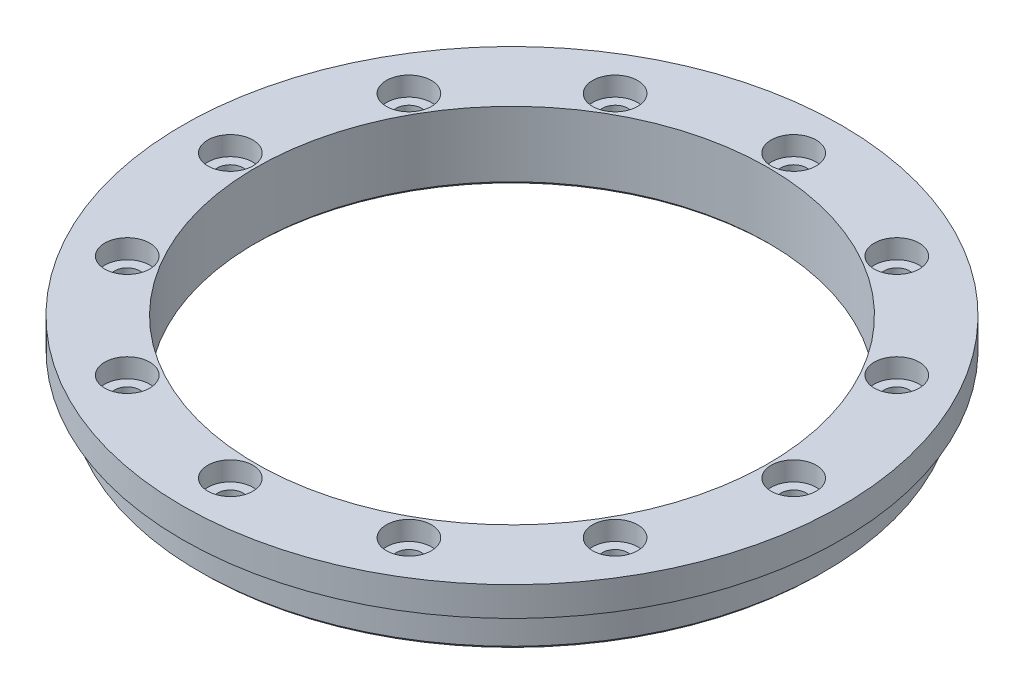
from build123d import *

# Parameters (mm, degrees)
CBORE_FOR_M4_HEX_SOCKET_HEAD_CAP_SCR_2_COUNT  = 2
CBORE_FOR_M4_HEX_SOCKET_HEAD_CAP_SCR_2_PITCH  = 25.88190451
CBORE_FOR_M4_HEX_SOCKET_HEAD_CAP_SCR_3_COUNT  = 2
CBORE_FOR_M4_HEX_SOCKET_HEAD_CAP_SCR_3_PITCH  = 50
CBORE_FOR_M4_HEX_SOCKET_HEAD_CAP_SCR_4_COUNT  = 2
CBORE_FOR_M4_HEX_SOCKET_HEAD_CAP_SCR_4_PITCH  = 70.710678119
CBORE_FOR_M4_HEX_SOCKET_HEAD_CAP_SCR_5_COUNT  = 2
CBORE_FOR_M4_HEX_SOCKET_HEAD_CAP_SCR_5_PITCH  = 86.602540378
CBORE_FOR_M4_HEX_SOCKET_HEAD_CAP_SCR_6_COUNT  = 2
CBORE_FOR_M4_HEX_SOCKET_HEAD_CAP_SCR_6_PITCH  = 96.592582629
CBORE_FOR_M4_HEX_SOCKET_HEAD_CAP_SCR_7_COUNT  = 2
CBORE_FOR_M4_HEX_SOCKET_HEAD_CAP_SCR_7_PITCH  = 100
CBORE_FOR_M4_HEX_SOCKET_HEAD_CAP_SCR_8_COUNT  = 2
CBORE_FOR_M4_HEX_SOCKET_HEAD_CAP_SCR_8_PITCH  = 96.592582629
CBORE_FOR_M4_HEX_SOCKET_HEAD_CAP_SCR_9_COUNT  = 2
CBORE_FOR_M4_HEX_SOCKET_HEAD_CAP_SCR_9_PITCH  = 86.602540378
CBORE_FOR_M4_HEX_SOCKET_HEAD_CAP_SCR_10_COUNT = 2
CBORE_FOR_M4_HEX_SOCKET_HEAD_CAP_SCR_10_PITCH = 70.710678119
CBORE_FOR_M4_HEX_SOCKET_HEAD_CAP_SCR_11_COUNT = 2
CBORE_FOR_M4_HEX_SOCKET_HEAD_CAP_SCR_11_PITCH = 50
CBORE_FOR_M4_HEX_SOCKET_HEAD_CAP_SCR_12_COUNT = 2
CBORE_FOR_M4_HEX_SOCKET_HEAD_CAP_SCR_12_PITCH = 25.88190451
M4_TAPPED_HOLE1_AT_2_COUNT                    = 2
M4_TAPPED_HOLE1_AT_2_PITCH                    = 25.88190451
M4_TAPPED_HOLE1_AT_3_COUNT                    = 2
M4_TAPPED_HOLE1_AT_3_PITCH                    = 50
M4_TAPPED_HOLE1_AT_4_COUNT                    = 2
M4_TAPPED_HOLE1_AT_4_PITCH                    = 70.710678119
M4_TAPPED_HOLE1_AT_5_COUNT                    = 2
M4_TAPPED_HOLE1_AT_5_PITCH                    = 86.602540378
M4_TAPPED_HOLE1_AT_6_COUNT                    = 2
M4_TAPPED_HOLE1_AT_6_PITCH                    = 96.592582629
M4_TAPPED_HOLE1_AT_7_COUNT                    = 2
M4_TAPPED_HOLE1_AT_7_PITCH                    = 100
M4_TAPPED_HOLE1_AT_8_COUNT                    = 2
M4_TAPPED_HOLE1_AT_8_PITCH                    = 96.592582629
M4_TAPPED_HOLE1_AT_9_COUNT                    = 2
M4_TAPPED_HOLE1_AT_9_PITCH                    = 86.602540378
M4_TAPPED_HOLE1_AT_10_COUNT                   = 2
M4_TAPPED_HOLE1_AT_10_PITCH                   = 70.710678119
M4_TAPPED_HOLE1_AT_11_COUNT                   = 2
M4_TAPPED_HOLE1_AT_11_PITCH                   = 50
M4_TAPPED_HOLE1_AT_12_COUNT                   = 2
M4_TAPPED_HOLE1_AT_12_PITCH                   = 25.88190451
SKETCH36_W                                    = 2.25
SKETCH36_H                                    = 3.5
M4_CLEARANCE_HOLE1_AT_2_COUNT                 = 2
M4_CLEARANCE_HOLE1_AT_2_PITCH                 = 35.58955921
M4_CLEARANCE_HOLE1_AT_3_COUNT                 = 2
M4_CLEARANCE_HOLE1_AT_3_PITCH                 = 65.76093065
M4_CLEARANCE_HOLE1_AT_4_COUNT                 = 2
M4_CLEARANCE_HOLE1_AT_4_PITCH                 = 85.920796524
M4_CLEARANCE_HOLE1_AT_5_COUNT                 = 2
M4_CLEARANCE_HOLE1_AT_5_PITCH                 = 93
M4_CLEARANCE_HOLE1_AT_6_COUNT                 = 2
M4_CLEARANCE_HOLE1_AT_6_PITCH                 = 85.920796524
M4_CLEARANCE_HOLE1_AT_7_COUNT                 = 2
M4_CLEARANCE_HOLE1_AT_7_PITCH                 = 65.76093065
M4_CLEARANCE_HOLE1_AT_8_COUNT                 = 2
M4_CLEARANCE_HOLE1_AT_8_PITCH                 = 35.58955921
M4_TAPPED_HOLE2_AT_2_COUNT                    = 2
M4_TAPPED_HOLE2_AT_2_PITCH                    = 35.58955921
M4_TAPPED_HOLE2_AT_3_COUNT                    = 2
M4_TAPPED_HOLE2_AT_3_PITCH                    = 35.58955921
M4_TAPPED_HOLE2_AT_4_COUNT                    = 2
M4_TAPPED_HOLE2_AT_4_PITCH                    = 65.76093065
M4_TAPPED_HOLE2_AT_5_COUNT                    = 2
M4_TAPPED_HOLE2_AT_5_PITCH                    = 65.76093065
M4_TAPPED_HOLE2_AT_6_COUNT                    = 2
M4_TAPPED_HOLE2_AT_6_PITCH                    = 85.920796524
M4_TAPPED_HOLE2_AT_7_COUNT                    = 2
M4_TAPPED_HOLE2_AT_7_PITCH                    = 93
M4_TAPPED_HOLE2_AT_8_COUNT                    = 2
M4_TAPPED_HOLE2_AT_8_PITCH                    = 85.920796524
SKETCH53_W                                    = 2.5
SKETCH53_H                                    = 54.5
M6_TAPPED_HOLE1_AT_2_COUNT                    = 2
M6_TAPPED_HOLE1_AT_2_PITCH                    = 45
MIRROR1_COPY_1_SKETCH_W                       = 2.5
MIRROR1_COPY_1_SKETCH_H                       = 54.5
SKETCH66_W                                    = 2.5
SKETCH66_H                                    = 54.5
M6_TAPPED_HOLE2_AT_2_COUNT                    = 2
M6_TAPPED_HOLE2_AT_2_PITCH                    = 45
MIRROR2_COPY_1_SKETCH_W                       = 2.5
MIRROR2_COPY_1_SKETCH_H                       = 54.5
SKETCH69_W                                    = 1
SKETCH69_H                                    = 1
CHAMFER5_SIZE                                 = 0.5
MOVE_FACE2_BY                                 = 0.5
MOVE_FACE3_BY                                 = 1
CHAMFER1_SIZE                                 = 0.6
CHAMFER2_SIZE                                 = 0.6
FILLET3_R                                     = 0.4
CHAMFER3_SIZE                                 = 2
M6_START                                      = -56
M6_TAPPED_HOLE3_OUTLINE_R                     = 2.5
M6_TAPPED_HOLE3_DEPTH                         = 14
CHAMFER4_SIZE                                 = 0.6
CHAMFER6_SIZE                                 = 0.6
FILLET4_R                                     = 0.4
CHAMFER7_SIZE                                 = 1
CHAMFER7_SIZE2                                = 1.732050808
CHAMFER8_SIZE                                 = 0.5
CHAMFER8_SIZE2                                = 0.866025404


with BuildPart() as part:
    # Sketch1 → Revolve1 (revolve)
    with BuildSketch(Plane(origin=(0, 0, 0), x_dir=(0, 0, -1), z_dir=(1, 0, 0))):
        Polygon((37, 103.8), (37, 100.8), (30.5, 100.8), (30.5, 96.8), (40, 93), (40, 91), (42.5, 91), (42.5, 78), (43, 78), (43, -18.5), (42.5, -18.5), (42.5, -31.5), (42.5, -32.5), (50.5, -32.5), (50.5, -36), (54.5, -36), (54.5, -32.5), (54.5, 43.7), (58.5, 43.7), (58.5, 49.7), (55.5, 49.7), (55.5, 57.7), (54.5, 57.7), (54.5, 90.3), (45.5, 90.3), (45.5, 103.8), (42.5, 103.8), align=None)
    revolve(axis=Axis((0, 0, 0), (0, 1, 0)))

    # Sketch56 → Cut-Revolve1 (revolve, cut)
    with BuildSketch(Plane(origin=(0, 0, 0), x_dir=(0, 0, -1), z_dir=(1, 0, 0))):
        Polygon((45.5, 103.8), (37, 103.8), (0, 103.8), (0, 93), (40, 93), (45.5, 93), align=None)
    revolve(axis=Axis((0, 108.9, 0), (0, -1, 0)), mode=Mode.SUBTRACT)

    # Sketch57 → Revolve4 (revolve)
    with BuildSketch(Plane(origin=(0, 0, 0), x_dir=(0, 0, -1), z_dir=(1, 0, 0))):
        Polygon((29.65, 98), (45.5, 98), (45.5, 93), (40, 93), (40, 95), (23.25, 95), (20.25, 95), (20.25, 102), (29.65, 102), align=None)
    revolve(axis=Axis((0, 108.9, 0), (0, -1, 0)))

    # Sketch22 → M4 Tapped Hole1 (revolve, cut)
    with BuildSketch(Plane(origin=(0, 90.3, -50), x_dir=(0, 0, 1), z_dir=(1, 0, 0))):
        Polygon((0, 0), (0, 11.091420021), (1.65, 10.1), (1.65, 0), align=None)
    m4_tapped_hole1 = revolve(axis=Axis((0, 96.65, -50), (0, -1, 0)), mode=Mode.SUBTRACT)

    # M4 Tapped Hole1 at 2: M4 Tapped Hole1 ×2
    with Locations(*[Vector(0.9659258262890645, 0, 0.2588190451025349) * (i * M4_TAPPED_HOLE1_AT_2_PITCH) for i in range(1, M4_TAPPED_HOLE1_AT_2_COUNT)]):
        add(m4_tapped_hole1, mode=Mode.SUBTRACT)

    # M4 Tapped Hole1 at 3: M4 Tapped Hole1 ×2
    with Locations(*[Vector(0.8660254037844238, 0, 0.5000000000000259) * (i * M4_TAPPED_HOLE1_AT_3_PITCH) for i in range(1, M4_TAPPED_HOLE1_AT_3_COUNT)]):
        add(m4_tapped_hole1, mode=Mode.SUBTRACT)

    # M4 Tapped Hole1 at 4: M4 Tapped Hole1 ×2
    with Locations(*[Vector(0.7071067811865159, 0, 0.7071067811865791) * (i * M4_TAPPED_HOLE1_AT_4_PITCH) for i in range(1, M4_TAPPED_HOLE1_AT_4_COUNT)]):
        add(m4_tapped_hole1, mode=Mode.SUBTRACT)

    # M4 Tapped Hole1 at 5: M4 Tapped Hole1 ×2
    with Locations(*[Vector(0.4999999999999484, 0, 0.8660254037844685) * (i * M4_TAPPED_HOLE1_AT_5_PITCH) for i in range(1, M4_TAPPED_HOLE1_AT_5_COUNT)]):
        add(m4_tapped_hole1, mode=Mode.SUBTRACT)

    # M4 Tapped Hole1 at 6: M4 Tapped Hole1 ×2
    with Locations(*[Vector(0.2588190451024489, 0, 0.9659258262890876) * (i * M4_TAPPED_HOLE1_AT_6_PITCH) for i in range(1, M4_TAPPED_HOLE1_AT_6_COUNT)]):
        add(m4_tapped_hole1, mode=Mode.SUBTRACT)

    # M4 Tapped Hole1 at 7: M4 Tapped Hole1 ×2
    with Locations(*[(0, 0, i * M4_TAPPED_HOLE1_AT_7_PITCH) for i in range(1, M4_TAPPED_HOLE1_AT_7_COUNT)]):
        add(m4_tapped_hole1, mode=Mode.SUBTRACT)

    # M4 Tapped Hole1 at 8: M4 Tapped Hole1 ×2
    with Locations(*[Vector(-0.2588190451026216, 0, 0.9659258262890413) * (i * M4_TAPPED_HOLE1_AT_8_PITCH) for i in range(1, M4_TAPPED_HOLE1_AT_8_COUNT)]):
        add(m4_tapped_hole1, mode=Mode.SUBTRACT)

    # M4 Tapped Hole1 at 9: M4 Tapped Hole1 ×2
    with Locations(*[Vector(-0.5000000000001033, 0, 0.8660254037843791) * (i * M4_TAPPED_HOLE1_AT_9_PITCH) for i in range(1, M4_TAPPED_HOLE1_AT_9_COUNT)]):
        add(m4_tapped_hole1, mode=Mode.SUBTRACT)

    # M4 Tapped Hole1 at 10: M4 Tapped Hole1 ×2
    with Locations(*[Vector(-0.7071067811866423, 0, 0.7071067811864528) * (i * M4_TAPPED_HOLE1_AT_10_PITCH) for i in range(1, M4_TAPPED_HOLE1_AT_10_COUNT)]):
        add(m4_tapped_hole1, mode=Mode.SUBTRACT)

    # M4 Tapped Hole1 at 11: M4 Tapped Hole1 ×2
    with Locations(*[Vector(-0.8660254037845131, 0, 0.4999999999998711) * (i * M4_TAPPED_HOLE1_AT_11_PITCH) for i in range(1, M4_TAPPED_HOLE1_AT_11_COUNT)]):
        add(m4_tapped_hole1, mode=Mode.SUBTRACT)

    # M4 Tapped Hole1 at 12: M4 Tapped Hole1 ×2
    with Locations(*[Vector(-0.9659258262891108, 0, 0.2588190451023622) * (i * M4_TAPPED_HOLE1_AT_12_PITCH) for i in range(1, M4_TAPPED_HOLE1_AT_12_COUNT)]):
        add(m4_tapped_hole1, mode=Mode.SUBTRACT)

    # Sketch39 → M4 Tapped Hole2 (revolve, cut)
    with BuildSketch(Plane(origin=(17.794779605, -32.5, -42.960398262), x_dir=(0, 0, -1), z_dir=(1, 0, 0))):
        Polygon((0, 0), (0, 10.991420021), (1.65, 10), (1.65, 0), align=None)
    m4_tapped_hole2 = revolve(axis=Axis((17.794779605, -38.85, -42.960398262), (0, 1, 0)), mode=Mode.SUBTRACT)

    # M4 Tapped Hole2 at 2: M4 Tapped Hole2 ×2
    with Locations(*[Vector(0.7071067811867017, 0, 0.7071067811863935) * (i * M4_TAPPED_HOLE2_AT_2_PITCH) for i in range(1, M4_TAPPED_HOLE2_AT_2_COUNT)]):
        add(m4_tapped_hole2, mode=Mode.SUBTRACT)

    # M4 Tapped Hole2 at 3: M4 Tapped Hole2 ×2
    with Locations(*[(-i * M4_TAPPED_HOLE2_AT_3_PITCH, 0, 0) for i in range(1, M4_TAPPED_HOLE2_AT_3_COUNT)]):
        add(m4_tapped_hole2, mode=Mode.SUBTRACT)

    # M4 Tapped Hole2 at 4: M4 Tapped Hole2 ×2
    with Locations(*[Vector(-0.9238795325112329, 0, 0.38268343236522007) * (i * M4_TAPPED_HOLE2_AT_4_PITCH) for i in range(1, M4_TAPPED_HOLE2_AT_4_COUNT)]):
        add(m4_tapped_hole2, mode=Mode.SUBTRACT)

    # M4 Tapped Hole2 at 5: M4 Tapped Hole2 ×2
    with Locations(*[Vector(0.38268343236527674, 0, 0.9238795325112094) * (i * M4_TAPPED_HOLE2_AT_5_PITCH) for i in range(1, M4_TAPPED_HOLE2_AT_5_COUNT)]):
        add(m4_tapped_hole2, mode=Mode.SUBTRACT)

    # M4 Tapped Hole2 at 6: M4 Tapped Hole2 ×2
    with Locations(*[(0, 0, i * M4_TAPPED_HOLE2_AT_6_PITCH) for i in range(1, M4_TAPPED_HOLE2_AT_6_COUNT)]):
        add(m4_tapped_hole2, mode=Mode.SUBTRACT)

    # M4 Tapped Hole2 at 7: M4 Tapped Hole2 ×2
    with Locations(*[Vector(-0.38268343236493113, 0, 0.9238795325113525) * (i * M4_TAPPED_HOLE2_AT_7_PITCH) for i in range(1, M4_TAPPED_HOLE2_AT_7_COUNT)]):
        add(m4_tapped_hole2, mode=Mode.SUBTRACT)

    # M4 Tapped Hole2 at 8: M4 Tapped Hole2 ×2
    with Locations(*[Vector(-0.707106781186437, 0, 0.707106781186658) * (i * M4_TAPPED_HOLE2_AT_8_PITCH) for i in range(1, M4_TAPPED_HOLE2_AT_8_COUNT)]):
        add(m4_tapped_hole2, mode=Mode.SUBTRACT)

    # Sketch53 → M6 Tapped Hole1 (revolve, cut)
    with BuildSketch(Plane(origin=(38.537319575, 30.5, 38.537319575), x_dir=(0.7071067811865464, 0, -0.7071067811865487), z_dir=(0, 1, 0))):
        with Locations((1.25, 27.25)):
            Rectangle(SKETCH53_W, SKETCH53_H)
    m6_tapped_hole1 = revolve(axis=Axis((43.027447635, 30.5, 43.027447635), (-0.7071067811865487, 0, -0.7071067811865464)), mode=Mode.SUBTRACT)

    # M6 Tapped Hole1 at 2: M6 Tapped Hole1 ×2
    with Locations(*[(0, -i * M6_TAPPED_HOLE1_AT_2_PITCH, 0) for i in range(1, M6_TAPPED_HOLE1_AT_2_COUNT)]):
        add(m6_tapped_hole1, mode=Mode.SUBTRACT)

    # Mirror1: M6 Tapped Hole1 across plane
    add(m6_tapped_hole1.mirror(Plane(origin=(0, 0, 0), x_dir=(0, 0, 1), z_dir=(1, 0, 0))), mode=Mode.SUBTRACT)

    # Mirror1 copy 1 sketch → Mirror1 copy 1 (revolve, cut)
    with BuildSketch(Plane(origin=(-38.537319575, -14.5, 38.537319575), x_dir=(-0.7071067811865464, 0, -0.7071067811865487), z_dir=(0, 1, 0))):
        with Locations((1.25, -27.25)):
            Rectangle(MIRROR1_COPY_1_SKETCH_W, MIRROR1_COPY_1_SKETCH_H)
    revolve(axis=Axis((-43.027447635, -14.5, 43.027447635), (-0.7071067811865487, 0, 0.7071067811865464)), mode=Mode.SUBTRACT)

    # AdvancedHole1: read off the stored shape, not the designer's step
    # AdvancedHole1 outline → AdvancedHole1 (revolve, cut)
    with BuildSketch(Plane.XY.offset(22.75)):
        Polygon((0.8, 100.5), (1.2, 100.5), (1.2, 102), (0, 102), (0, 96.019311506), (0.8, 96.5), align=None)
    revolve(axis=Axis((0, 0, 22.75), (0, 1, 0)), mode=Mode.SUBTRACT)

    # AdvancedHole1 2 outline → AdvancedHole1 2 (revolve, cut)
    with BuildSketch(Plane(origin=(19.702077936, 0, -11.375), x_dir=(1, 0, 0), z_dir=(0, 0, 1))):
        Polygon((1.2, 102), (0, 102), (0, 96.019311506), (0.8, 96.5), (0.8, 100.5), (1.2, 100.5), align=None)
    revolve(axis=Axis((19.702077936, 0, -11.375), (0, 1, 0)), mode=Mode.SUBTRACT)

    # AdvancedHole1 3 outline → AdvancedHole1 3 (revolve, cut)
    with BuildSketch(Plane(origin=(-19.702077936, 0, -11.375), x_dir=(1, 0, 0), z_dir=(0, 0, 1))):
        Polygon((1.2, 102), (0, 102), (0, 96.019311506), (0.8, 96.5), (0.8, 100.5), (1.2, 100.5), align=None)
    revolve(axis=Axis((-19.702077936, 0, -11.375), (0, 1, 0)), mode=Mode.SUBTRACT)

    # Sketch66 → M6 Tapped Hole2 (revolve, cut)
    with BuildSketch(Plane(origin=(31.259915781, 30.5, 44.643786414), x_dir=(0.819152044288993, 0, -0.5735764363510444), z_dir=(0, 1, 0))):
        with Locations((1.25, 27.25)):
            Rectangle(SKETCH66_W, SKETCH66_H)
    m6_tapped_hole2 = revolve(axis=Axis((34.902126152, 30.5, 49.845401895), (-0.5735764363510444, 0, -0.8191520442889929)), mode=Mode.SUBTRACT)

    # M6 Tapped Hole2 at 2: M6 Tapped Hole2 ×2
    with Locations(*[(0, -i * M6_TAPPED_HOLE2_AT_2_PITCH, 0) for i in range(1, M6_TAPPED_HOLE2_AT_2_COUNT)]):
        add(m6_tapped_hole2, mode=Mode.SUBTRACT)

    # Mirror2: M6 Tapped Hole2 across plane
    add(m6_tapped_hole2.mirror(Plane(origin=(0, 0, 0), x_dir=(0, 0, 1), z_dir=(1, 0, 0))), mode=Mode.SUBTRACT)

    # Mirror2 copy 1 sketch → Mirror2 copy 1 (revolve, cut)
    with BuildSketch(Plane(origin=(-31.259915781, -14.5, 44.643786414), x_dir=(-0.819152044288993, 0, -0.5735764363510444), z_dir=(0, 1, 0))):
        with Locations((1.25, -27.25)):
            Rectangle(MIRROR2_COPY_1_SKETCH_W, MIRROR2_COPY_1_SKETCH_H)
    revolve(axis=Axis((-34.902126152, -14.5, 49.845401895), (-0.5735764363510444, 0, 0.8191520442889929)), mode=Mode.SUBTRACT)


with BuildPart() as body_2:
    # Sketch2 → Revolve2 (revolve)
    with BuildSketch(Plane(origin=(0, 0, 0), x_dir=(0, 0, -1), z_dir=(1, 0, 0)), mode=Mode.PRIVATE) as revolve2_sk:
        Polygon((42.5, -31.5), (40, -31.5), (40, -36), (50.5, -36), (50.5, -32.5), (42.5, -32.5), align=None)
    revolve(revolve2_sk.sketch.rotate(Axis((0, 108.9, 0), (0, -1, 0)), 180), axis=Axis((0, 108.9, 0), (0, -1, 0)))

    # Sketch36 → M4 Clearance Hole1 (revolve, cut)
    with BuildSketch(Plane(origin=(17.794779605, -36, -42.960398262), x_dir=(0, 0, -1), z_dir=(1, 0, 0))):
        with Locations((1.125, 1.75)):
            Rectangle(SKETCH36_W, SKETCH36_H)
    m4_clearance_hole1 = revolve(axis=Axis((17.794779605, -42.35, -42.960398262), (0, 1, 0)), mode=Mode.SUBTRACT)

    # M4 Clearance Hole1 at 2: M4 Clearance Hole1 ×2
    with Locations(*[(-i * M4_CLEARANCE_HOLE1_AT_2_PITCH, 0, 0) for i in range(1, M4_CLEARANCE_HOLE1_AT_2_COUNT)]):
        add(m4_clearance_hole1, mode=Mode.SUBTRACT)

    # M4 Clearance Hole1 at 3: M4 Clearance Hole1 ×2
    with Locations(*[Vector(-0.9238795325112329, 0, 0.38268343236522007) * (i * M4_CLEARANCE_HOLE1_AT_3_PITCH) for i in range(1, M4_CLEARANCE_HOLE1_AT_3_COUNT)]):
        add(m4_clearance_hole1, mode=Mode.SUBTRACT)

    # M4 Clearance Hole1 at 4: M4 Clearance Hole1 ×2
    with Locations(*[Vector(-0.707106781186437, 0, 0.707106781186658) * (i * M4_CLEARANCE_HOLE1_AT_4_PITCH) for i in range(1, M4_CLEARANCE_HOLE1_AT_4_COUNT)]):
        add(m4_clearance_hole1, mode=Mode.SUBTRACT)

    # M4 Clearance Hole1 at 5: M4 Clearance Hole1 ×2
    with Locations(*[Vector(-0.38268343236493113, 0, 0.9238795325113525) * (i * M4_CLEARANCE_HOLE1_AT_5_PITCH) for i in range(1, M4_CLEARANCE_HOLE1_AT_5_COUNT)]):
        add(m4_clearance_hole1, mode=Mode.SUBTRACT)

    # M4 Clearance Hole1 at 6: M4 Clearance Hole1 ×2
    with Locations(*[(0, 0, i * M4_CLEARANCE_HOLE1_AT_6_PITCH) for i in range(1, M4_CLEARANCE_HOLE1_AT_6_COUNT)]):
        add(m4_clearance_hole1, mode=Mode.SUBTRACT)

    # M4 Clearance Hole1 at 7: M4 Clearance Hole1 ×2
    with Locations(*[Vector(0.38268343236527674, 0, 0.9238795325112094) * (i * M4_CLEARANCE_HOLE1_AT_7_PITCH) for i in range(1, M4_CLEARANCE_HOLE1_AT_7_COUNT)]):
        add(m4_clearance_hole1, mode=Mode.SUBTRACT)

    # M4 Clearance Hole1 at 8: M4 Clearance Hole1 ×2
    with Locations(*[Vector(0.7071067811867017, 0, 0.7071067811863935) * (i * M4_CLEARANCE_HOLE1_AT_8_PITCH) for i in range(1, M4_CLEARANCE_HOLE1_AT_8_COUNT)]):
        add(m4_clearance_hole1, mode=Mode.SUBTRACT)

    # Move Face2: a face moved inward by 0.5
    extrude(body_2.faces().sort_by_distance((40.4, -32.5, -25.25))[0], amount=MOVE_FACE2_BY, dir=(0, -1, 0), mode=Mode.SUBTRACT)

    # Fillet3
    fillet3_edges = [body_2.edges().sort_by_distance(p)[0] for p in [
        (0, -33, -42.5),
    ]]
    fillet(fillet3_edges, radius=FILLET3_R)

    # Chamfer4
    chamfer4_edges = [body_2.edges().sort_by_distance(p)[0] for p in [
        (0, -33, -50.5),
    ]]
    chamfer(chamfer4_edges, length=CHAMFER4_SIZE)


with BuildPart() as body_3:
    # Sketch3 → Revolve3 (revolve)
    with BuildSketch(Plane(origin=(0, 0, 0), x_dir=(0, 0, -1), z_dir=(1, 0, 0))):
        Polygon((45.5, 90.3), (55.5, 90.3), (55.5, 98.3), (58.5, 98.3), (58.5, 103.5), (45.5, 103.5), align=None)
    revolve(axis=Axis((0, 0, 0), (0, 1, 0)))

    # Sketch19 → CBORE for M4 Hex Socket Head Cap Screw1 (revolve, cut)
    with BuildSketch(Plane(origin=(-25, 103.5, -43.301270189), x_dir=(0, 0, 1), z_dir=(1, 0, 0))):
        Polygon((0, 0), (0, 14.551936393), (2.25, 13.2), (2.25, 3.4), (4, 3.4), (4, 0), align=None)
    cbore_for_m4_hex_socket_head_cap_screw1 = revolve(axis=Axis((-25, 109.85, -43.301270189), (0, -1, 0)), mode=Mode.SUBTRACT)

    # CBORE for M4 Hex Socket Head Cap Scr 2: CBORE for M4 Hex Socket Head Cap Screw1 ×2
    with Locations(*[Vector(0.9659258262891108, 0, -0.2588190451023622) * (i * CBORE_FOR_M4_HEX_SOCKET_HEAD_CAP_SCR_2_PITCH) for i in range(1, CBORE_FOR_M4_HEX_SOCKET_HEAD_CAP_SCR_2_COUNT)]):
        add(cbore_for_m4_hex_socket_head_cap_screw1, mode=Mode.SUBTRACT)

    # CBORE for M4 Hex Socket Head Cap Scr 3: CBORE for M4 Hex Socket Head Cap Screw1 ×2
    with Locations(*[(i * CBORE_FOR_M4_HEX_SOCKET_HEAD_CAP_SCR_3_PITCH, 0, 0) for i in range(1, CBORE_FOR_M4_HEX_SOCKET_HEAD_CAP_SCR_3_COUNT)]):
        add(cbore_for_m4_hex_socket_head_cap_screw1, mode=Mode.SUBTRACT)

    # CBORE for M4 Hex Socket Head Cap Scr 4: CBORE for M4 Hex Socket Head Cap Screw1 ×2
    with Locations(*[Vector(0.9659258262890181, 0, 0.25881904510270803) * (i * CBORE_FOR_M4_HEX_SOCKET_HEAD_CAP_SCR_4_PITCH) for i in range(1, CBORE_FOR_M4_HEX_SOCKET_HEAD_CAP_SCR_4_COUNT)]):
        add(cbore_for_m4_hex_socket_head_cap_screw1, mode=Mode.SUBTRACT)

    # CBORE for M4 Hex Socket Head Cap Scr 5: CBORE for M4 Hex Socket Head Cap Screw1 ×2
    with Locations(*[Vector(0.8660254037843342, 0, 0.5000000000001809) * (i * CBORE_FOR_M4_HEX_SOCKET_HEAD_CAP_SCR_5_PITCH) for i in range(1, CBORE_FOR_M4_HEX_SOCKET_HEAD_CAP_SCR_5_COUNT)]):
        add(cbore_for_m4_hex_socket_head_cap_screw1, mode=Mode.SUBTRACT)

    # CBORE for M4 Hex Socket Head Cap Scr 6: CBORE for M4 Hex Socket Head Cap Screw1 ×2
    with Locations(*[Vector(0.7071067811863894, 0, 0.7071067811867057) * (i * CBORE_FOR_M4_HEX_SOCKET_HEAD_CAP_SCR_6_PITCH) for i in range(1, CBORE_FOR_M4_HEX_SOCKET_HEAD_CAP_SCR_6_COUNT)]):
        add(cbore_for_m4_hex_socket_head_cap_screw1, mode=Mode.SUBTRACT)

    # CBORE for M4 Hex Socket Head Cap Scr 7: CBORE for M4 Hex Socket Head Cap Screw1 ×2
    with Locations(*[Vector(0.4999999999997935, 0, 0.866025403784558) * (i * CBORE_FOR_M4_HEX_SOCKET_HEAD_CAP_SCR_7_PITCH) for i in range(1, CBORE_FOR_M4_HEX_SOCKET_HEAD_CAP_SCR_7_COUNT)]):
        add(cbore_for_m4_hex_socket_head_cap_screw1, mode=Mode.SUBTRACT)

    # CBORE for M4 Hex Socket Head Cap Scr 8: CBORE for M4 Hex Socket Head Cap Screw1 ×2
    with Locations(*[Vector(0.25881904510227594, 0, 0.9659258262891339) * (i * CBORE_FOR_M4_HEX_SOCKET_HEAD_CAP_SCR_8_PITCH) for i in range(1, CBORE_FOR_M4_HEX_SOCKET_HEAD_CAP_SCR_8_COUNT)]):
        add(cbore_for_m4_hex_socket_head_cap_screw1, mode=Mode.SUBTRACT)

    # CBORE for M4 Hex Socket Head Cap Scr 9: CBORE for M4 Hex Socket Head Cap Screw1 ×2
    with Locations(*[(0, 0, i * CBORE_FOR_M4_HEX_SOCKET_HEAD_CAP_SCR_9_PITCH) for i in range(1, CBORE_FOR_M4_HEX_SOCKET_HEAD_CAP_SCR_9_COUNT)]):
        add(cbore_for_m4_hex_socket_head_cap_screw1, mode=Mode.SUBTRACT)

    # CBORE for M4 Hex Socket Head Cap Scr 10: CBORE for M4 Hex Socket Head Cap Screw1 ×2
    with Locations(*[Vector(-0.2588190451027944, 0, 0.9659258262889949) * (i * CBORE_FOR_M4_HEX_SOCKET_HEAD_CAP_SCR_10_PITCH) for i in range(1, CBORE_FOR_M4_HEX_SOCKET_HEAD_CAP_SCR_10_COUNT)]):
        add(cbore_for_m4_hex_socket_head_cap_screw1, mode=Mode.SUBTRACT)

    # CBORE for M4 Hex Socket Head Cap Scr 11: CBORE for M4 Hex Socket Head Cap Screw1 ×2
    with Locations(*[Vector(-0.5000000000002581, 0, 0.8660254037842897) * (i * CBORE_FOR_M4_HEX_SOCKET_HEAD_CAP_SCR_11_PITCH) for i in range(1, CBORE_FOR_M4_HEX_SOCKET_HEAD_CAP_SCR_11_COUNT)]):
        add(cbore_for_m4_hex_socket_head_cap_screw1, mode=Mode.SUBTRACT)

    # CBORE for M4 Hex Socket Head Cap Scr 12: CBORE for M4 Hex Socket Head Cap Screw1 ×2
    with Locations(*[Vector(-0.7071067811867687, 0, 0.7071067811863263) * (i * CBORE_FOR_M4_HEX_SOCKET_HEAD_CAP_SCR_12_PITCH) for i in range(1, CBORE_FOR_M4_HEX_SOCKET_HEAD_CAP_SCR_12_COUNT)]):
        add(cbore_for_m4_hex_socket_head_cap_screw1, mode=Mode.SUBTRACT)


with BuildPart() as cut_revolve2_tool:
    # Sketch69 → Cut-Revolve2 (revolve)
    with BuildSketch(Plane(origin=(0, 0, 0), x_dir=(0, 0, -1), z_dir=(1, 0, 0))):
        with Locations((55, 97.8)):
            Rectangle(SKETCH69_W, SKETCH69_H)
        with Locations((55, 50.2)):
            Rectangle(SKETCH69_W, SKETCH69_H)
    revolve(axis=Axis((0, 108.9, 0), (0, -1, 0)))


with BuildPart() as part_1:
    add(part.part)

    # Cut-Revolve2: cut by cut_revolve2_tool
    add(cut_revolve2_tool.part, mode=Mode.SUBTRACT)

    # Chamfer5
    chamfer5_edges = [part_1.edges().sort_by_distance(p)[0] for p in [
        (0, -18.5, 42.5),
        (0, 78, 42.5),
    ]]
    chamfer(chamfer5_edges, length=CHAMFER5_SIZE - 0.0001)  # a hair under: the kernel refuses the full size

    # Chamfer3
    chamfer3_edges = [part_1.edges().sort_by_distance(p)[0] for p in [
        (0, 95, 20.25),
    ]]
    chamfer(chamfer3_edges, length=CHAMFER3_SIZE)

    # M6 Tapped Hole3: read off the stored shape, not the designer's step
    # M6 Tapped Hole3 outline → M6 Tapped Hole3 (cut)
    with BuildSketch(Plane.XY.offset(M6_START)):
        with Locations((0, -6.3)):
            Circle(M6_TAPPED_HOLE3_OUTLINE_R)
        with Locations((0, 23.7)):
            Circle(M6_TAPPED_HOLE3_OUTLINE_R)
    extrude(amount=M6_TAPPED_HOLE3_DEPTH, mode=Mode.SUBTRACT)

    # Chamfer6
    chamfer6_edges = [part_1.edges().sort_by_distance(p)[0] for p in [
        (0, 57.7, 55.5),
        (0, -32.5, 42.5),
    ]]
    chamfer(chamfer6_edges, length=CHAMFER6_SIZE)

    # Fillet4
    fillet4_edges = [part_1.edges().sort_by_distance(p)[0] for p in [
        (0, 91, 42.5),
        (0, 90.3, 45.5),
        (0, -32.5, 50.5),
    ]]
    fillet(fillet4_edges, radius=FILLET4_R)

    # Chamfer7
    chamfer7_edges = [part_1.edges().sort_by_distance(p)[0] for p in [
        (0, 98, 45.5),
    ]]
    chamfer7_side = [part_1.faces().sort_by_distance(p)[0] for p in [
        (0, 98, 30.936934342),
    ]]
    chamfer(chamfer7_edges, length=CHAMFER7_SIZE, length2=CHAMFER7_SIZE2, reference=chamfer7_side[0])

    # Chamfer8
    chamfer8_edges = [part_1.edges().sort_by_distance(p)[0] for p in [
        (0, -36, 50.5),
    ]]
    chamfer8_side = [part_1.faces().sort_by_distance(p)[0] for p in [
        (0, -36, 52.041492783),
    ]]
    chamfer(chamfer8_edges, length=CHAMFER8_SIZE, length2=CHAMFER8_SIZE2, reference=chamfer8_side[0])


with BuildPart() as body_3_1:
    add(body_3.part)

    # Cut-Revolve2: cut by cut_revolve2_tool
    add(cut_revolve2_tool.part, mode=Mode.SUBTRACT)

    # Move Face3: a face moved inward by 1.0
    extrude(body_3_1.faces().sort_by_distance((44.4, 90.3, -27.75))[0], amount=MOVE_FACE3_BY, dir=(0, 1, 0), mode=Mode.SUBTRACT)

    # Chamfer1
    chamfer1_edges = [body_3_1.edges().sort_by_distance(p)[0] for p in [
        (0, 91.3, 45.5),
    ]]
    chamfer(chamfer1_edges, length=CHAMFER1_SIZE)

    # Chamfer2
    chamfer2_edges = [body_3_1.edges().sort_by_distance(p)[0] for p in [
        (0, 91.3, 55.5),
    ]]
    chamfer(chamfer2_edges, length=CHAMFER2_SIZE)


solid = body_3_1.part
